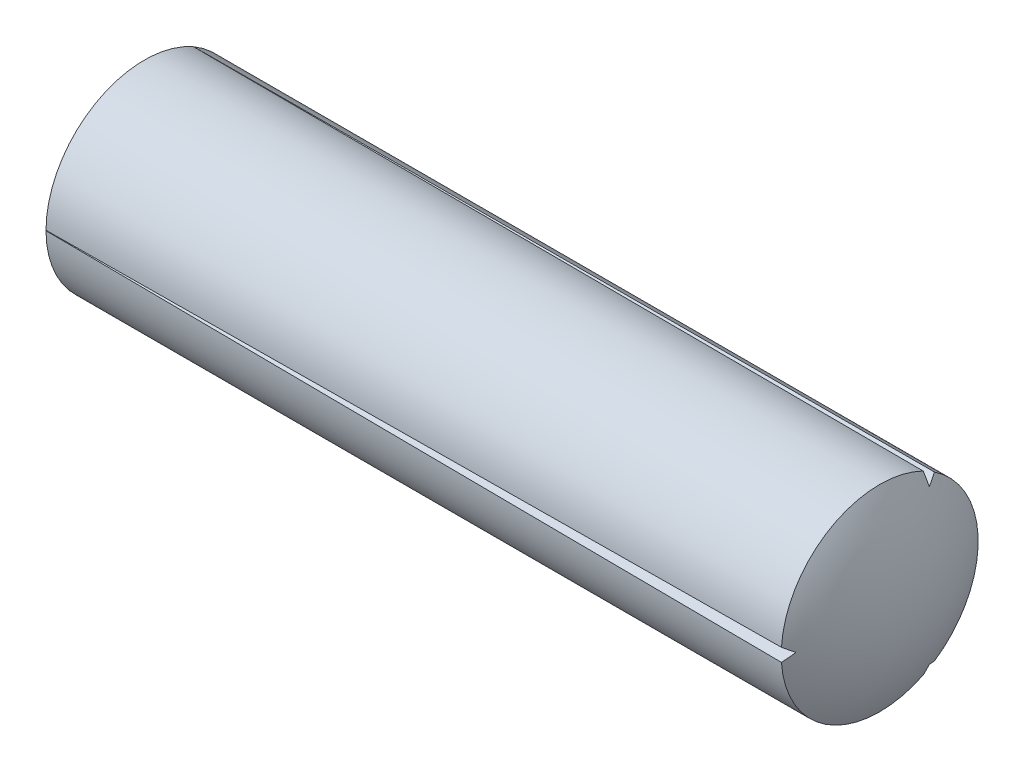
from build123d import *

# Parameters (mm, degrees)
CIRPATTERN1_COUNT = 3


with BuildPart() as part:
    # Sketch1 → Base-Revolve (revolve)
    with BuildSketch(Plane.XY):
        with BuildLine():
            Line((-100, 0), (-100, 1.25))
            ThreePointArc((-100, 1.25), (-99.010050505, 7.072345027), (-96.68190465, 12.5))
            Line((-96.68190465, 12.5), (-3.349364905, 12.5))
            ThreePointArc((-3.349364905, 12.5), (-0.851854343, 6.470476128), (0, 0))
            Line((0, 0), (-100, 0))
        make_face()
    revolve(axis=Axis((-40, 0, 0), (1, 0, 0)))

    # Cut-Sweep1: sweep along a path in Sketch4
    with BuildLine(Plane(origin=(0, 0, 0), x_dir=(1, 0, 0), z_dir=(0, 1, 0))) as cut_sweep1_path:
        Line((0, -11.25), (-100, -12.5))
    # Sketch2 → Cut-Sweep1 (sweep, cut)
    with BuildSketch(Plane(origin=(0, 0, 0), x_dir=(0, 0, -1), z_dir=(1, 0, 0))):
        Polygon((-11.25, 0), (-12.5, 0.875259423), (-12.5, -0.875259423), align=None)
    cut_sweep1 = sweep(path=cut_sweep1_path.line, mode=Mode.SUBTRACT)

    # CirPattern1: Cut-Sweep1 ×3 about axis
    cirpattern1_axis = Axis((-40, 0, 0), (1, 0, 0))
    for i in range(1, CIRPATTERN1_COUNT):
        add(cut_sweep1.rotate(cirpattern1_axis, i * 360 / CIRPATTERN1_COUNT), mode=Mode.SUBTRACT)


solid = part.part
